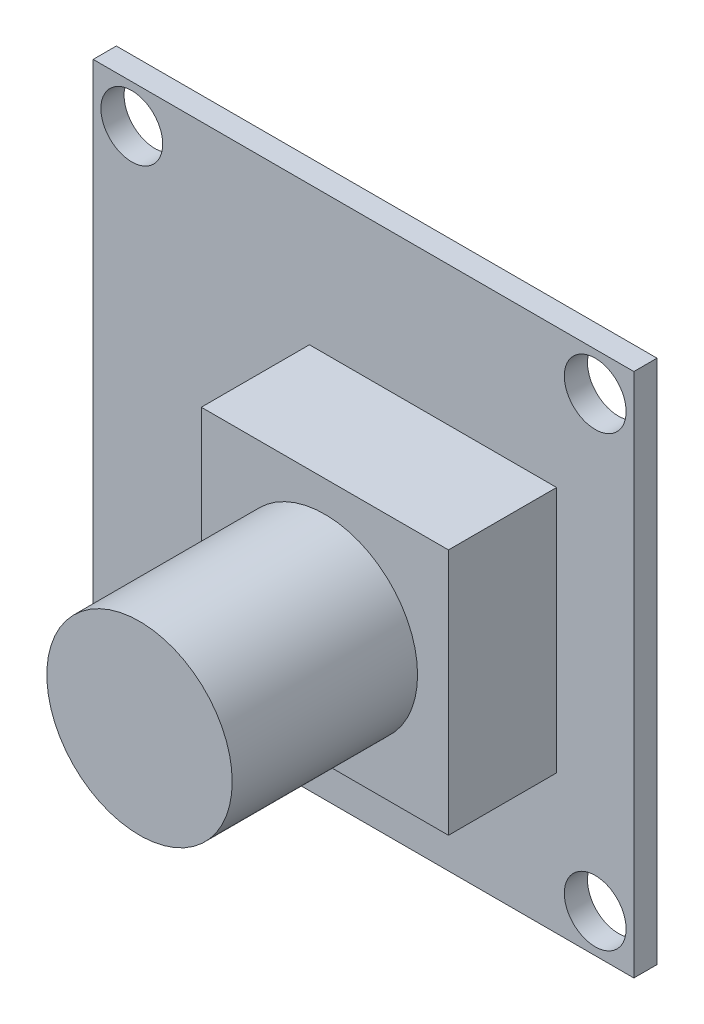
from build123d import *

# Parameters (mm, degrees)
SKETCH1_W           = 35
SKETCH1_H           = 34
BOSS_EXTRUDE1_DEPTH = 1.5
CUT_EXTRUDE1_REACH  = 26.444
SKETCH2_R           = 2
SKETCH3_W           = 16
SKETCH3_H           = 16
BOSS_EXTRUDE3_DEPTH = 7
SKETCH4_R           = 6
BOSS_EXTRUDE4_DEPTH = 12


with BuildPart() as part:
    # Sketch1 → Boss-Extrude1 (new body)
    with BuildSketch(Plane.XY):
        Rectangle(SKETCH1_W, SKETCH1_H)
    extrude(amount=-BOSS_EXTRUDE1_DEPTH)

    # Sketch2 → Cut-Extrude1 (cut, up to next)
    with BuildSketch(Plane.XY, mode=Mode.PRIVATE) as cut_extrude1_sk1:
        with Locations((-15, -14.5)):
            Circle(SKETCH2_R)
    cut_extrude1_tool1 = extrude(cut_extrude1_sk1.sketch, amount=-CUT_EXTRUDE1_REACH, mode=Mode.PRIVATE) & part.part
    # Sketch2 → Cut-Extrude1 (cut, up to next)
    with BuildSketch(Plane.XY, mode=Mode.PRIVATE) as cut_extrude1_sk2:
        with Locations((15, -14.5)):
            Circle(SKETCH2_R)
    cut_extrude1_tool2 = extrude(cut_extrude1_sk2.sketch, amount=-CUT_EXTRUDE1_REACH, mode=Mode.PRIVATE) & part.part
    # Sketch2 → Cut-Extrude1 (cut, up to next)
    with BuildSketch(Plane.XY, mode=Mode.PRIVATE) as cut_extrude1_sk3:
        with Locations((15, 14.5)):
            Circle(SKETCH2_R)
    cut_extrude1_tool3 = extrude(cut_extrude1_sk3.sketch, amount=-CUT_EXTRUDE1_REACH, mode=Mode.PRIVATE) & part.part
    # Sketch2 → Cut-Extrude1 (cut, up to next)
    with BuildSketch(Plane.XY, mode=Mode.PRIVATE) as cut_extrude1_sk4:
        with Locations((-15, 14.5)):
            Circle(SKETCH2_R)
    cut_extrude1_tool4 = extrude(cut_extrude1_sk4.sketch, amount=-CUT_EXTRUDE1_REACH, mode=Mode.PRIVATE) & part.part
    add(cut_extrude1_tool1.solids().sort_by_distance((-15, -14.5, 0))[0], mode=Mode.SUBTRACT)
    add(cut_extrude1_tool2.solids().sort_by_distance((15, -14.5, 0))[0], mode=Mode.SUBTRACT)
    add(cut_extrude1_tool3.solids().sort_by_distance((15, 14.5, 0))[0], mode=Mode.SUBTRACT)
    add(cut_extrude1_tool4.solids().sort_by_distance((-15, 14.5, 0))[0], mode=Mode.SUBTRACT)

    # Sketch3 → Boss-Extrude3 (add)
    with BuildSketch(Plane.XY):
        with Locations((4.5, 0)):
            Rectangle(SKETCH3_W, SKETCH3_H)
    extrude(amount=BOSS_EXTRUDE3_DEPTH)

    # Sketch4 → Boss-Extrude4 (add)
    with BuildSketch(Plane.XY.offset(7)):
        with Locations((4.5, 0)):
            Circle(SKETCH4_R)
    extrude(amount=BOSS_EXTRUDE4_DEPTH)


solid = part.part
